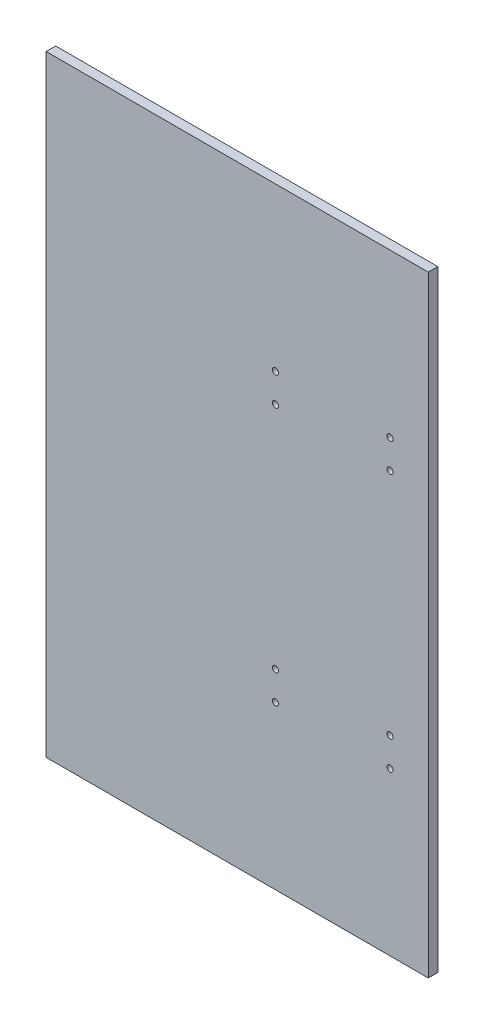
from build123d import *

# Parameters (mm, degrees)
SKETCH1_W           = 200
SKETCH1_H           = 320
BOSS_EXTRUDE1_DEPTH = 5
CUT_EXTRUDE1_REACH  = 190.746
SKETCH2_R           = 1.6


with BuildPart() as part:
    # Sketch1 → Boss-Extrude1 (new body)
    with BuildSketch(Plane.XY):
        Rectangle(SKETCH1_W, SKETCH1_H)
    extrude(amount=BOSS_EXTRUDE1_DEPTH)

    # Sketch2 → Cut-Extrude1 (cut, up to next)
    with BuildSketch(Plane(origin=(0, 0, 0), x_dir=(-1, 0, 0), z_dir=(0, 0, -1)), mode=Mode.PRIVATE) as cut_extrude1_sk1:
        with Locations((-80, 75)):
            Circle(SKETCH2_R)
    cut_extrude1_tool1 = extrude(cut_extrude1_sk1.sketch, amount=-CUT_EXTRUDE1_REACH, mode=Mode.PRIVATE) & part.part
    # Sketch2 → Cut-Extrude1 (cut, up to next)
    with BuildSketch(Plane(origin=(0, 0, 0), x_dir=(-1, 0, 0), z_dir=(0, 0, -1)), mode=Mode.PRIVATE) as cut_extrude1_sk2:
        with Locations((-80, 60)):
            Circle(SKETCH2_R)
    cut_extrude1_tool2 = extrude(cut_extrude1_sk2.sketch, amount=-CUT_EXTRUDE1_REACH, mode=Mode.PRIVATE) & part.part
    # Sketch2 → Cut-Extrude1 (cut, up to next)
    with BuildSketch(Plane(origin=(0, 0, 0), x_dir=(-1, 0, 0), z_dir=(0, 0, -1)), mode=Mode.PRIVATE) as cut_extrude1_sk3:
        with Locations((-80, -60)):
            Circle(SKETCH2_R)
    cut_extrude1_tool3 = extrude(cut_extrude1_sk3.sketch, amount=-CUT_EXTRUDE1_REACH, mode=Mode.PRIVATE) & part.part
    # Sketch2 → Cut-Extrude1 (cut, up to next)
    with BuildSketch(Plane(origin=(0, 0, 0), x_dir=(-1, 0, 0), z_dir=(0, 0, -1)), mode=Mode.PRIVATE) as cut_extrude1_sk4:
        with Locations((-80, -75)):
            Circle(SKETCH2_R)
    cut_extrude1_tool4 = extrude(cut_extrude1_sk4.sketch, amount=-CUT_EXTRUDE1_REACH, mode=Mode.PRIVATE) & part.part
    # Sketch2 → Cut-Extrude1 (cut, up to next)
    with BuildSketch(Plane(origin=(0, 0, 0), x_dir=(-1, 0, 0), z_dir=(0, 0, -1)), mode=Mode.PRIVATE) as cut_extrude1_sk5:
        with Locations((-20, -75)):
            Circle(SKETCH2_R)
    cut_extrude1_tool5 = extrude(cut_extrude1_sk5.sketch, amount=-CUT_EXTRUDE1_REACH, mode=Mode.PRIVATE) & part.part
    # Sketch2 → Cut-Extrude1 (cut, up to next)
    with BuildSketch(Plane(origin=(0, 0, 0), x_dir=(-1, 0, 0), z_dir=(0, 0, -1)), mode=Mode.PRIVATE) as cut_extrude1_sk6:
        with Locations((-20, -60)):
            Circle(SKETCH2_R)
    cut_extrude1_tool6 = extrude(cut_extrude1_sk6.sketch, amount=-CUT_EXTRUDE1_REACH, mode=Mode.PRIVATE) & part.part
    # Sketch2 → Cut-Extrude1 (cut, up to next)
    with BuildSketch(Plane(origin=(0, 0, 0), x_dir=(-1, 0, 0), z_dir=(0, 0, -1)), mode=Mode.PRIVATE) as cut_extrude1_sk7:
        with Locations((-20, 60)):
            Circle(SKETCH2_R)
    cut_extrude1_tool7 = extrude(cut_extrude1_sk7.sketch, amount=-CUT_EXTRUDE1_REACH, mode=Mode.PRIVATE) & part.part
    # Sketch2 → Cut-Extrude1 (cut, up to next)
    with BuildSketch(Plane(origin=(0, 0, 0), x_dir=(-1, 0, 0), z_dir=(0, 0, -1)), mode=Mode.PRIVATE) as cut_extrude1_sk8:
        with Locations((-20, 75)):
            Circle(SKETCH2_R)
    cut_extrude1_tool8 = extrude(cut_extrude1_sk8.sketch, amount=-CUT_EXTRUDE1_REACH, mode=Mode.PRIVATE) & part.part
    add(cut_extrude1_tool1.solids().sort_by_distance((80, 75, 0))[0], mode=Mode.SUBTRACT)
    add(cut_extrude1_tool2.solids().sort_by_distance((80, 60, 0))[0], mode=Mode.SUBTRACT)
    add(cut_extrude1_tool3.solids().sort_by_distance((80, -60, 0))[0], mode=Mode.SUBTRACT)
    add(cut_extrude1_tool4.solids().sort_by_distance((80, -75, 0))[0], mode=Mode.SUBTRACT)
    add(cut_extrude1_tool5.solids().sort_by_distance((20, -75, 0))[0], mode=Mode.SUBTRACT)
    add(cut_extrude1_tool6.solids().sort_by_distance((20, -60, 0))[0], mode=Mode.SUBTRACT)
    add(cut_extrude1_tool7.solids().sort_by_distance((20, 60, 0))[0], mode=Mode.SUBTRACT)
    add(cut_extrude1_tool8.solids().sort_by_distance((20, 75, 0))[0], mode=Mode.SUBTRACT)


solid = part.part
